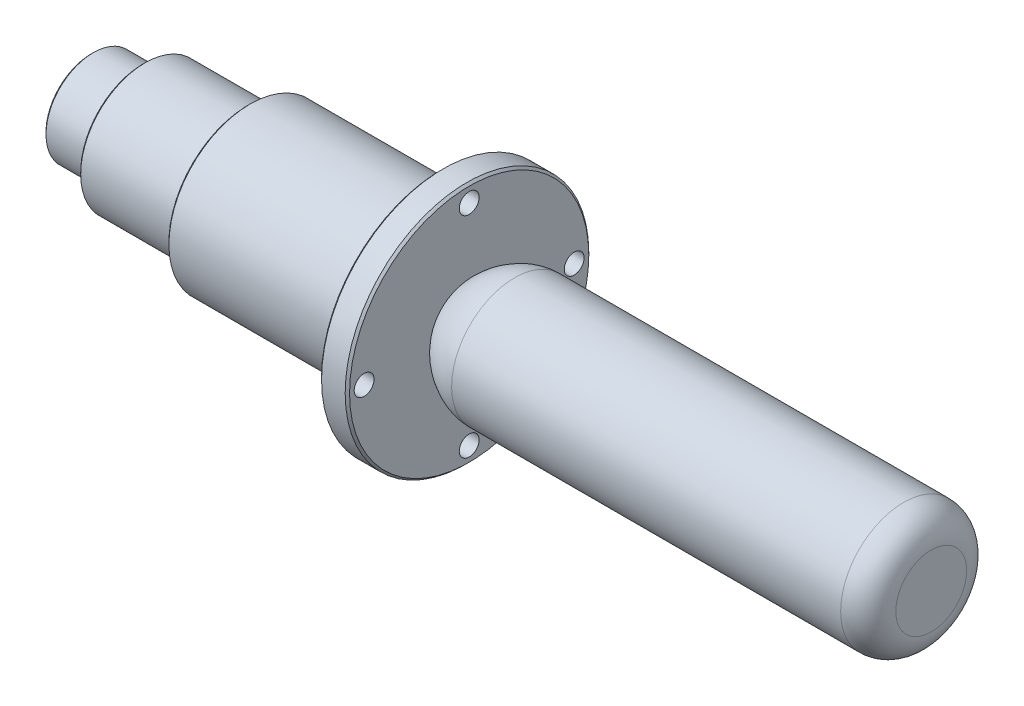
from build123d import *

# Parameters (mm, degrees)
CUT_EXTRUDE1_REACH = 91.456
SKETCH2_R          = 1.8034
CIRPATTERN2_COUNT  = 4
CHAMFER1_SIZE      = 0.396875


with BuildPart() as part:
    # Sketch1 → Revolve1 (revolve)
    with BuildSketch(Plane.XY):
        with BuildLine():
            Line((-19.670349573, 0), (-19.670349573, 8.580640426))
            Line((-19.670349573, 8.580640426), (-10.272349573, 8.580640426))
            Line((-10.272349573, 8.580640426), (-10.272349573, 11.684))
            Line((-10.272349573, 11.684), (8.777650427, 11.684))
            Line((8.777650427, 11.684), (8.777650427, 14.732))
            Line((8.777650427, 14.732), (43.829650427, 14.732))
            Line((43.829650427, 14.732), (43.829650427, 22.098))
            Line((43.829650427, 22.098), (48.909650427, 22.098))
            Line((48.909650427, 22.098), (48.909650427, 7.055193239))
            add(Edge.make_bspline(
                [(48.909650427, 7.055193239), (50.745745469, 9.469407322), (54.078310122, 11.43), (57.155980429, 11.43)],
                knots=[0, 0, 0, 0, 1, 1, 1, 1], degree=3))
            Line((57.155980429, 11.43), (127.729650427, 11.43))
            ThreePointArc((127.729650427, 11.43), (131.265184333, 9.965533906), (132.729650427, 6.43))
            Line((132.729650427, 6.43), (132.729650427, 0))
            Line((132.729650427, 0), (-19.670349573, 0))
        make_face()
    revolve(axis=Axis((-19.670349573, 0, 0), (1, 0, 0)))

    # Sketch2 → Cut-Extrude1 (cut, up to next)
    with BuildSketch(Plane(origin=(48.909650427, 0, 0), x_dir=(0, 0, -1), z_dir=(1, 0, 0)), mode=Mode.PRIVATE) as cut_extrude1_sk1:
        with Locations((0, 19.05)):
            Circle(SKETCH2_R)
    cut_extrude1_tool1 = extrude(cut_extrude1_sk1.sketch, amount=-CUT_EXTRUDE1_REACH, mode=Mode.PRIVATE) & part.part
    cut_extrude1 = cut_extrude1_tool1.solids().sort_by_distance((48.90965, 19.05, 0))[0]
    add(cut_extrude1, mode=Mode.SUBTRACT)

    # CirPattern2: Cut-Extrude1 ×4 about axis
    cirpattern2_axis = Axis((48.909650427, 0, 0), (-1, 0, 0))
    for i in range(1, CIRPATTERN2_COUNT):
        add(cut_extrude1.rotate(cirpattern2_axis, i * 360 / CIRPATTERN2_COUNT), mode=Mode.SUBTRACT)

    # Chamfer1
    chamfer1_edges = [part.edges().sort_by_distance(p)[0] for p in [
        (48.909650427, -22.098, 0),
        (43.829650427, -22.098, 0),
        (8.777650427, -14.732, 0),
        (-10.272349573, -11.684, 0),
        (-19.670349573, -8.580640426, 0),
    ]]
    chamfer(chamfer1_edges, length=CHAMFER1_SIZE)


solid = part.part
